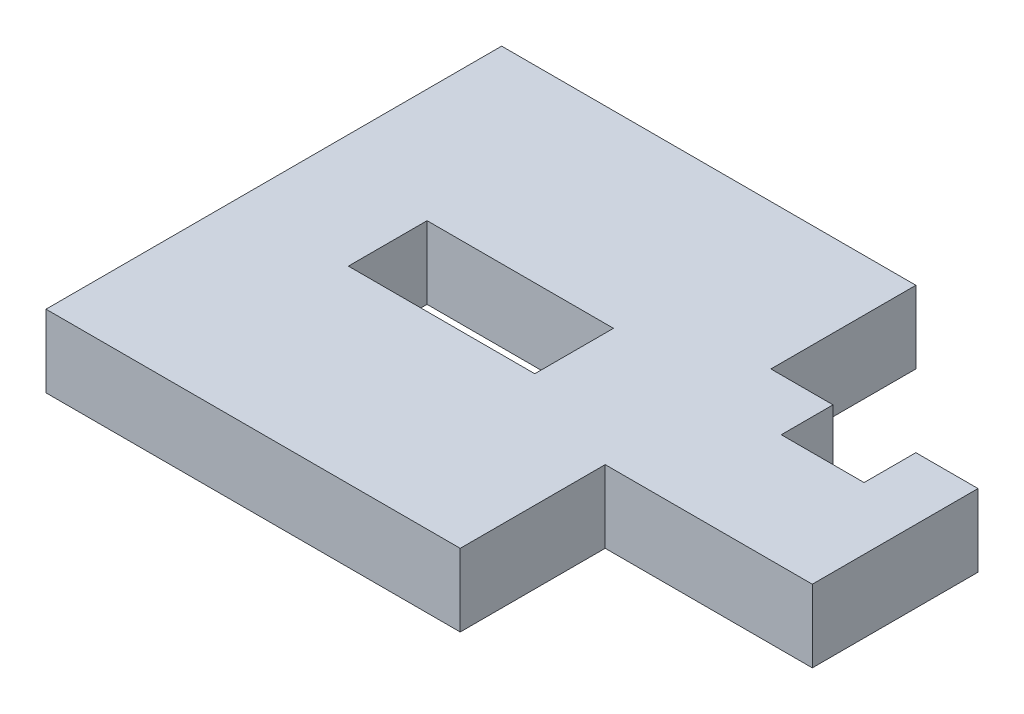
from build123d import *

# Parameters (mm, degrees)
SKETCH1_W           = 20
SKETCH1_H           = 22
SKETCH1_W_2         = 9
SKETCH1_H_2         = 3.8
BOSS_EXTRUDE1_DEPTH = 4
SKETCH2_W           = 10
SKETCH2_H           = 8
BOSS_EXTRUDE3_DEPTH = 4
SKETCH3_W           = 4
SKETCH3_H           = 2.5
CUT_EXTRUDE1_DEPTH  = 24.173260453
CHAMFER1_SIZE       = 0.5


with BuildPart() as part:
    # Sketch1 → Boss-Extrude1 (new body)
    with BuildSketch(Plane(origin=(0, 0, 0), x_dir=(1, 0, 0), z_dir=(0, 1, 0))):
        Rectangle(SKETCH1_W, SKETCH1_H)
        Rectangle(SKETCH1_W_2, SKETCH1_H_2, mode=Mode.SUBTRACT)
    extrude(amount=BOSS_EXTRUDE1_DEPTH)

    # Sketch2 → Boss-Extrude3 (add)
    with BuildSketch(Plane(origin=(0, 0, 0), x_dir=(1, 0, 0), z_dir=(0, 1, 0))):
        with Locations((15, 0)):
            Rectangle(SKETCH2_W, SKETCH2_H)
    extrude(amount=BOSS_EXTRUDE3_DEPTH)

    # Sketch3 → Cut-Extrude1 (cut, through all)
    with BuildSketch(Plane(origin=(0, 0, 0), x_dir=(1, 0, 0), z_dir=(0, 1, 0))):
        with Locations((15, 2.75)):
            Rectangle(SKETCH3_W, SKETCH3_H)
    extrude(amount=CUT_EXTRUDE1_DEPTH, mode=Mode.SUBTRACT)

    # Chamfer1
    chamfer1_edges = [part.edges().sort_by_distance(p)[0] for p in [
        (0, 0, -11),
        (-10, 0, 0),
        (0, 0, 11),
        (10, 0, 7.5),
        (15, 0, 4),
        (20, 0, 0),
        (18.5, 0, -4),
        (17, 0, -2.75),
        (15, 0, -1.5),
        (10, 0, -7.5),
        (0, 0, 1.9),
        (-4.5, 0, 0),
        (0, 0, -1.9),
        (4.5, 0, 0),
        (11.5, 0, -4),
        (13, 0, -2.75),
    ]]
    chamfer(chamfer1_edges, length=CHAMFER1_SIZE)


solid = part.part
